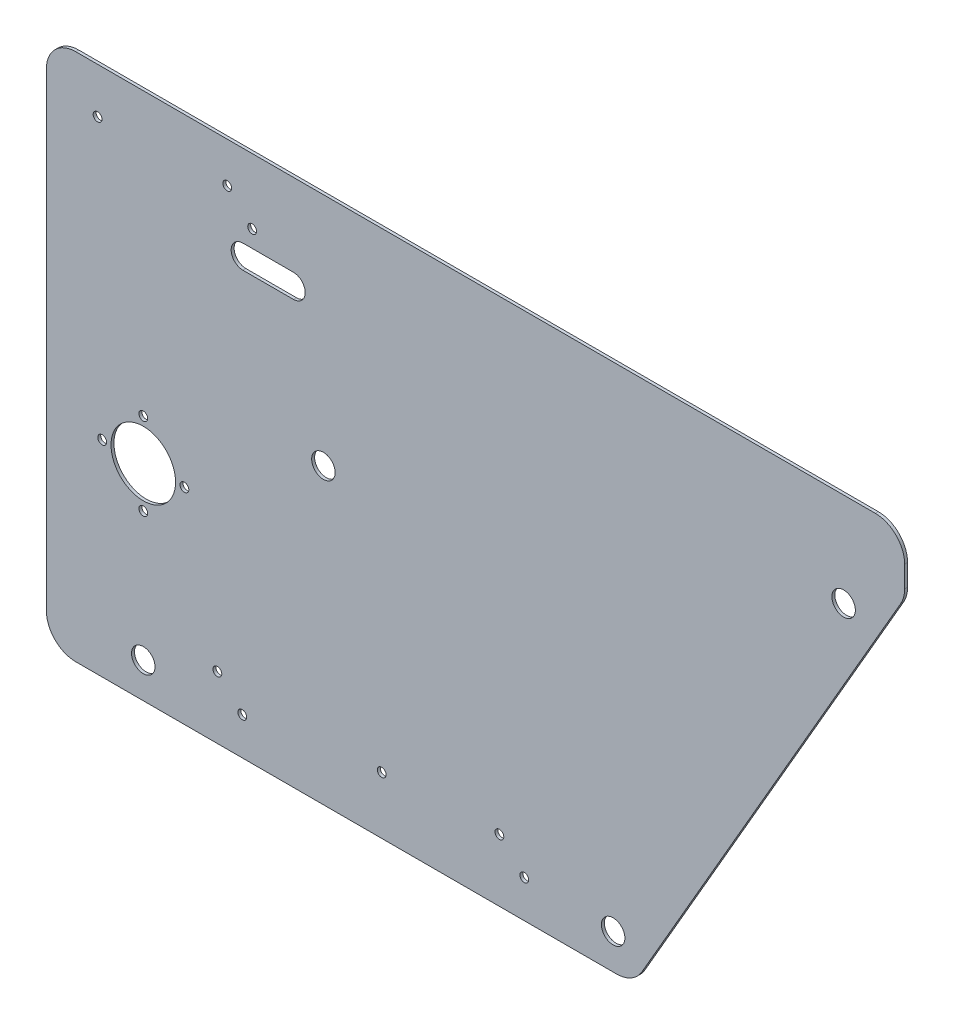
from build123d import *

# Parameters (mm, degrees)
BOSS_EXTRUDE1_DEPTH = 1
FILLET1_R           = 10
SKETCH2_R           = 4
SKETCH2_R_2         = 11
SKETCH2_R_3         = 1.5
CUT_EXTRUDE1_DEPTH  = 3


with BuildPart() as part:
    # Sketch1 → Boss-Extrude1 (new body)
    with BuildSketch(Plane.XY):
        Polygon((-100, 100), (-100, -80), (100, -80), (192.37604307, 80), (192.37604307, 100), align=None)
    extrude(amount=BOSS_EXTRUDE1_DEPTH)

    # Fillet1
    fillet1_edges = [part.edges().sort_by_distance(p)[0] for p in [
        (100, -80, 0.5),
        (-100, -80, 0.5),
        (192.37604307, 100, 0.5),
        (-100, 100, 0.5),
        (192.37604307, 80, 0.5),
    ]]
    fillet(fillet1_edges, radius=FILLET1_R)

    # Sketch2 → Cut-Extrude1 (cut)
    with BuildSketch(Plane.XY.offset(1)):
        with Locations((93.07179677, -68)):
            Circle(SKETCH2_R)
        with Locations((171.59143338, 68)):
            Circle(SKETCH2_R)
        with Locations((-67, -10)):
            Circle(SKETCH2_R_2)
        with Locations((-67, -68)):
            Circle(SKETCH2_R)
        with Locations((-53, -10)):
            Circle(SKETCH2_R_3)
        with Locations((-67, 4)):
            Circle(SKETCH2_R_3)
        with Locations((-81, -10)):
            Circle(SKETCH2_R_3)
        with Locations((-67, -24)):
            Circle(SKETCH2_R_3)
        with Locations((-5.638951331, 20)):
            Circle(SKETCH2_R)
        with Locations((62.79605759, -67.242640687)):
            Circle(SKETCH2_R_3)
        with Locations((54.310776216, -58.757359313)):
            Circle(SKETCH2_R_3)
        with Locations((-33.274226936, -67.242640687)):
            Circle(SKETCH2_R_3)
        with Locations((-41.75950831, -58.757359313)):
            Circle(SKETCH2_R_3)
        with Locations((14.225855729, -60.5)):
            Circle(SKETCH2_R_3)
        with Locations((-29.915208807, 77.757359313)):
            Circle(SKETCH2_R_3)
        with Locations((-38.400490181, 86.242640687)):
            Circle(SKETCH2_R_3)
        with Locations((-82.576317869, 84.5)):
            Circle(SKETCH2_R_3)
        with BuildLine():
            Line((-33.05915155, 72), (-15.842898152, 72))
            ThreePointArc((-15.842898152, 72), (-11.842898152, 68), (-15.842898152, 64))
            Line((-15.842898152, 64), (-33.05915155, 64))
            ThreePointArc((-33.05915155, 64), (-37.05915155, 68), (-33.05915155, 72))
        make_face()
    extrude(amount=-CUT_EXTRUDE1_DEPTH, mode=Mode.SUBTRACT)


solid = part.part
